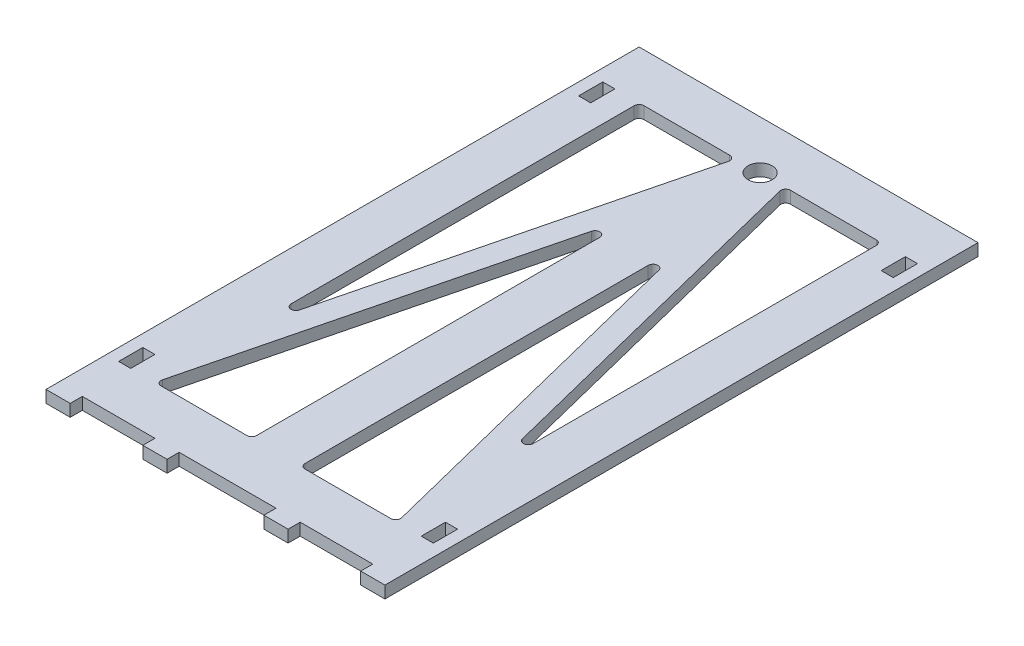
from build123d import *

# Parameters (mm, degrees)
SKETCH1_W         = 6.35
SKETCH1_H         = 12.7
SKETCH1_R         = 6.35
FRONT_PANEL_DEPTH = 6.35
FILLET1_R         = 2.54


with BuildPart() as part:
    # Sketch1 → Front Panel (new body)
    with BuildSketch(Plane(origin=(0, 0, 0), x_dir=(1, 0, 0), z_dir=(0, 1, 0))):
        Polygon((0, 304.8), (0, -6.35), (12.7, -6.35), (12.7, 0), (50.8, 0), (50.8, -6.35), (63.5, -6.35), (63.5, 0), (114.3, 0), (114.3, -6.35), (127, -6.35), (127, 0), (165.1, 0), (165.1, -6.35), (177.8, -6.35), (177.8, 304.8), align=None)
        with Locations((9.525, 31.75)):
            Rectangle(SKETCH1_W, SKETCH1_H, mode=Mode.SUBTRACT)
        Polygon((25.4, 25.4), (76.2, 228.6), (76.2, 25.4), align=None, mode=Mode.SUBTRACT)
        with Locations((168.275, 31.75)):
            Rectangle(SKETCH1_W, SKETCH1_H, mode=Mode.SUBTRACT)
        Polygon((101.6, 25.4), (101.6, 228.6), (152.4, 25.4), align=None, mode=Mode.SUBTRACT)
        Polygon((25.4, 279.4), (76.2, 279.4), (25.4, 76.2), align=None, mode=Mode.SUBTRACT)
        with Locations((9.525, 273.05)):
            Rectangle(SKETCH1_W, SKETCH1_H, mode=Mode.SUBTRACT)
        Polygon((152.4, 76.2), (101.6, 279.4), (152.4, 279.4), align=None, mode=Mode.SUBTRACT)
        with Locations((88.9, 279.4)):
            Circle(SKETCH1_R, mode=Mode.SUBTRACT)
        with Locations((168.275, 273.05)):
            Rectangle(SKETCH1_W, SKETCH1_H, mode=Mode.SUBTRACT)
    extrude(amount=FRONT_PANEL_DEPTH)

    # Fillet1
    fillet1_edges = [part.edges().sort_by_distance(p)[0] for p in [
        (25.4, 3.175, -76.2),
        (152.4, 3.175, -76.2),
        (25.4, 3.175, -25.4),
        (76.2, 3.175, -25.4),
        (101.6, 3.175, -25.4),
        (152.4, 3.175, -25.4),
        (76.2, 3.175, -228.6),
        (101.6, 3.175, -228.6),
        (25.4, 3.175, -279.4),
        (76.2, 3.175, -279.4),
        (101.6, 3.175, -279.4),
        (152.4, 3.175, -279.4),
    ]]
    fillet(fillet1_edges, radius=FILLET1_R)


solid = part.part
